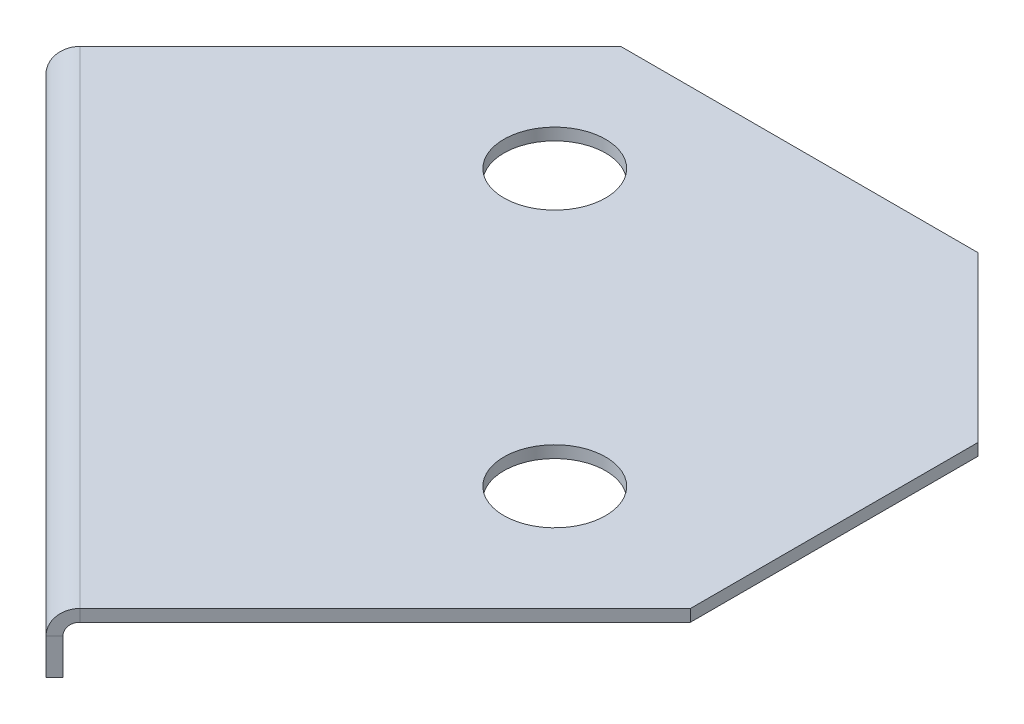
from build123d import *

# Parameters (mm, degrees)
BASE_FLANGE1_DEPTH           = 0.2
EDGE_FLANGE1_STRIP_W         = 1.2
EDGE_FLANGE1_STRIP_H         = 0.2
EDGE_FLANGE1_STRIP_CUT_DEPTH = 11.5
EDGE_FLANGE1_DEPTH           = 11.5
F_1_7_1_7_DIAMETER_HOLE1_D   = 1.7


# Sheet-metal steps are written as plain solids
with BuildPart() as part:
    # Sketch1 → Base-Flange1 (new body)
    with BuildSketch(Plane(origin=(0, 0, 0), x_dir=(1, 0, 0), z_dir=(0, 1, 0))):
        Polygon((5.75399352, 10.137943159), (-0.213435895, 10.137943159), (-4.873652989, 5.477726065), (3.258074995, -2.654001919), (8.5, 2.587923086), (8.5, 7.391936679), align=None)
    extrude(amount=-BASE_FLANGE1_DEPTH)

    # Edge-Flange1 strip (across the edge) → Edge-Flange1 strip cut (cut)
    with BuildSketch(Plane(origin=(3.258074995, -0.2, 2.654001919), x_dir=(0.707106781186555, -3.4914813388431337e-15, -0.70710678118654), z_dir=(-0.70710678118654, 0, -0.707106781186555))):
        with Locations((-0.4, -0.1)):
            Rectangle(EDGE_FLANGE1_STRIP_W, EDGE_FLANGE1_STRIP_H)
    extrude(amount=EDGE_FLANGE1_STRIP_CUT_DEPTH, mode=Mode.SUBTRACT)

    # Edge-Flange1 section (across the edge) → Edge-Flange1 (add)
    with BuildSketch(Plane(origin=(3.258074995, -0.2, 2.654001919), x_dir=(0.707106781186555, -3.4914813388431337e-15, -0.70710678118654), z_dir=(-0.70710678118654, 0, -0.707106781186555))):
        with BuildLine():
            Line((-0.2, 0.2), (-0.2, 0.8))
            Line((-0.2, 0.8), (0, 0.8))
            Line((0, 0.8), (0, 0.2))
            ThreePointArc((0, 0.2), (0.058578644, 0.058578644), (0.2, 0))
            Line((0.2, 0), (0.2, -0.2))
            ThreePointArc((0.2, -0.2), (-0.082842712, -0.082842712), (-0.2, 0.2))
        make_face()
    extrude(amount=EDGE_FLANGE1_DEPTH)

    # Ø1.7 (1.7) Diameter Hole1 (through all)
    with Locations(Plane(origin=(0, 0, 0), x_dir=(1, 0, 0), z_dir=(0, 1, 0))):
        with Locations((1.00251186, 7.818357007), (5.598705937, 3.22216293)):
            Hole(F_1_7_1_7_DIAMETER_HOLE1_D / 2)


solid = part.part
